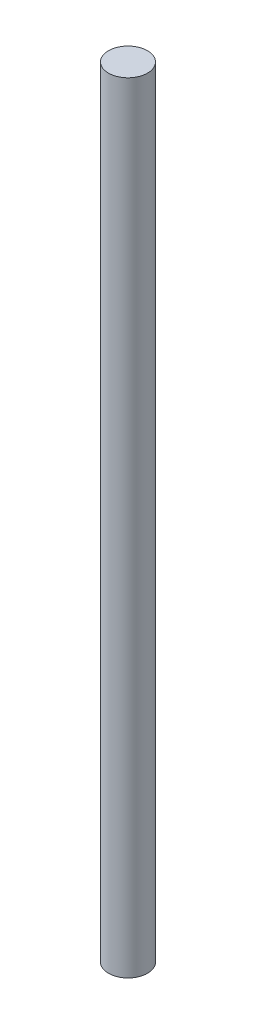
from build123d import *

# Parameters (mm, degrees)
SKETCH1_R           = 2.5
BOSS_EXTRUDE1_DEPTH = 100.076


with BuildPart() as part:
    # Sketch1 → Boss-Extrude1 (new body)
    with BuildSketch(Plane(origin=(0, 0, 0), x_dir=(1, 0, 0), z_dir=(0, 1, 0))):
        Circle(SKETCH1_R)
    extrude(amount=BOSS_EXTRUDE1_DEPTH)


solid = part.part
